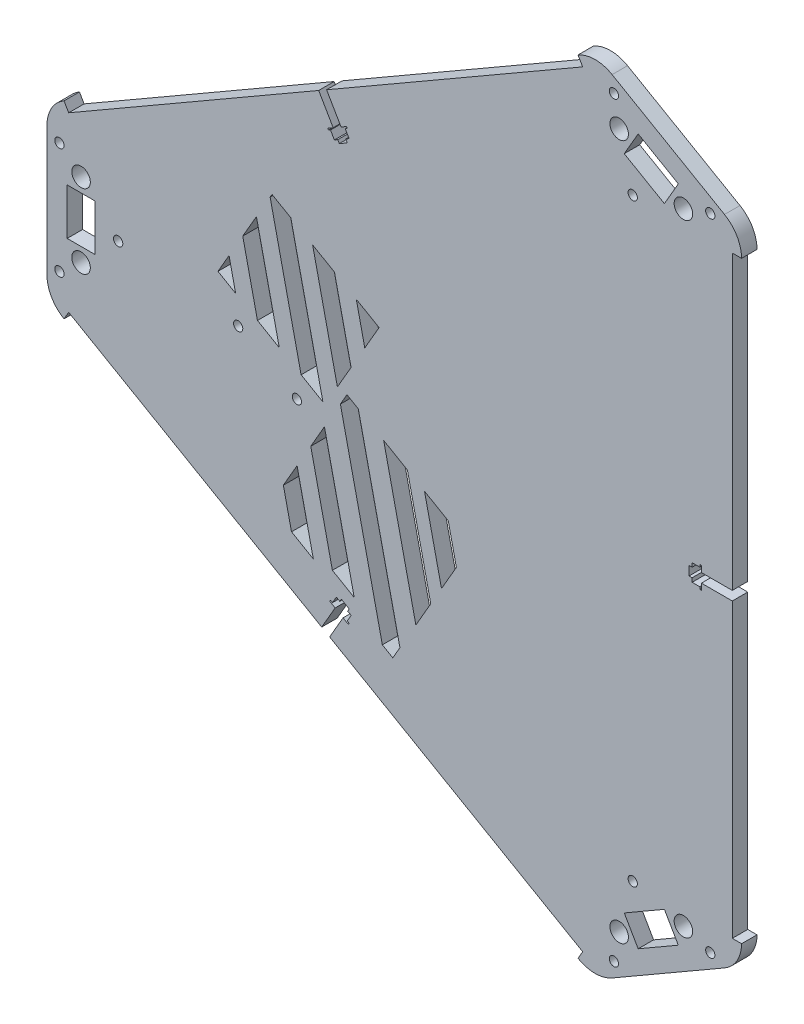
from build123d import *

# Parameters (mm, degrees)
SKETCH1_R           = 3
SKETCH1_R_2         = 1.5
SKETCH1_W           = 9
SKETCH1_H           = 15
BOSS_EXTRUDE1_DEPTH = 5
CUT_EXTRUDE1_DEPTH  = 186.427912319
CUT_EXTRUDE2_DEPTH  = 186.427912319
CUT_EXTRUDE3_DEPTH  = 10
SKETCH4_R           = 1.5
CUT_EXTRUDE4_DEPTH  = 10


with BuildPart() as part:
    # Sketch1 → Boss-Extrude1 (new body)
    with BuildSketch(Plane.XY):
        with BuildLine():
            Line((-127.0125, 27.949853865), (39.300966521, 123.970978531))
            Line((39.300966521, 123.970978531), (37.800966521, 126.569054742))
            ThreePointArc((37.800966521, 126.569054742), (43.313466521, 128.046124665), (48.825966521, 126.569054742))
            Line((48.825966521, 126.569054742), (85.199033479, 105.569054742))
            ThreePointArc((85.199033479, 105.569054742), (89.234463556, 101.533624665), (90.711533479, 96.021124665))
            Line((90.711533479, 96.021124665), (87.711533479, 96.021124665))
            Line((87.711533479, 96.021124665), (87.711533479, -96.021124665))
            Line((87.711533479, -96.021124665), (90.711533479, -96.021124665))
            ThreePointArc((90.711533479, -96.021124665), (89.234463556, -101.533624665), (85.199033479, -105.569054742))
            Line((85.199033479, -105.569054742), (48.825966521, -126.569054742))
            ThreePointArc((48.825966521, -126.569054742), (43.313465898, -128.046124665), (37.800965443, -126.56905412))
            Line((37.800965443, -126.56905412), (39.300965736, -123.970978078))
            Line((39.300965736, -123.970978078), (-127.012489947, -27.949834641))
            Line((-127.012489947, -27.949834641), (-128.512501078, -30.547929455))
            ThreePointArc((-128.512501078, -30.547929455), (-132.547930388, -26.512499461), (-134.025, -21))
            Line((-134.025, -21), (-134.025, 21))
            ThreePointArc((-134.025, 21), (-132.547930077, 26.5125), (-128.5125, 30.547930077))
            Line((-128.5125, 30.547930077), (-127.0125, 27.949853865))
        make_face()
        with Locations((-123, 12)):
            Circle(SKETCH1_R, mode=Mode.SUBTRACT)
        with Locations((-123, -12)):
            Circle(SKETCH1_R, mode=Mode.SUBTRACT)
        with Locations((71.892304845, 100.521124665)):
            Circle(SKETCH1_R, mode=Mode.SUBTRACT)
        with Locations((51.107695155, 112.521124665)):
            Circle(SKETCH1_R, mode=Mode.SUBTRACT)
        with Locations((51.107695155, -112.521124665)):
            Circle(SKETCH1_R, mode=Mode.SUBTRACT)
        with Locations((71.892304845, -100.521124665)):
            Circle(SKETCH1_R, mode=Mode.SUBTRACT)
        with Locations((-111, 0)):
            Circle(SKETCH1_R_2, mode=Mode.SUBTRACT)
        with Locations((55.5, 96.12881982)):
            Circle(SKETCH1_R_2, mode=Mode.SUBTRACT)
        with Locations((55.5, -96.12881982)):
            Circle(SKETCH1_R_2, mode=Mode.SUBTRACT)
        with Locations((-130, 18)):
            Circle(SKETCH1_R_2, mode=Mode.SUBTRACT)
        with Locations((-130, -18)):
            Circle(SKETCH1_R_2, mode=Mode.SUBTRACT)
        with Locations((80.588457268, 103.583302492)):
            Circle(SKETCH1_R_2, mode=Mode.SUBTRACT)
        with Locations((49.411542732, 121.583302492)):
            Circle(SKETCH1_R_2, mode=Mode.SUBTRACT)
        with Locations((49.411542732, -121.583302492)):
            Circle(SKETCH1_R_2, mode=Mode.SUBTRACT)
        with Locations((80.588457268, -103.583302492)):
            Circle(SKETCH1_R_2, mode=Mode.SUBTRACT)
        Polygon((57.254809472, -114.168238983), (70.245190528, -106.668238983), (65.745190528, -98.874010348), (52.754809472, -106.374010348), align=None, mode=Mode.SUBTRACT)
        with Locations((-123, 0)):
            Rectangle(SKETCH1_W, SKETCH1_H, mode=Mode.SUBTRACT)
        Polygon((65.745190528, 98.874010348), (52.754809472, 106.374010348), (57.254809472, 114.168238983), (70.245190528, 106.668238983), align=None, mode=Mode.SUBTRACT)
    extrude(amount=BOSS_EXTRUDE1_DEPTH)

    # Sketch2 → Cut-Extrude1 (cut, through all)
    with BuildSketch(Plane.XY.offset(5)):
        Polygon((87.711533479, 1.48), (77.711533479, 1.48), (77.711533479, 3.5), (77.211533479, 3.5), (77.211533479, 2.75), (74.711533479, 2.75), (74.711533479, 1.48), (73.711533479, 1.48), (73.711533479, -1.48), (74.711533479, -1.48), (74.711533479, -2.75), (77.211533479, -2.75), (77.211533479, -3.5), (77.711533479, -3.5), (77.711533479, -1.48), (87.711533479, -1.48), align=None)
        Polygon((-43.223568195, -77.825416198), (-38.223568195, -69.16516216), (-36.474196879, -70.17516216), (-36.224196879, -69.742149458), (-36.873715932, -69.367149458), (-35.623715932, -67.202085949), (-36.723568195, -66.567085949), (-36.223568195, -65.701060545), (-38.78700339, -64.221060545), (-39.28700339, -65.087085949), (-40.386855653, -64.452085949), (-41.636855653, -66.617149458), (-42.286374706, -66.242149458), (-42.536374706, -66.67516216), (-40.78700339, -67.68516216), (-45.78700339, -76.345416198), align=None)
        Polygon((-46.436522443, 75.220416198), (-41.436522443, 66.56016216), (-43.185893759, 65.55016216), (-42.935893759, 65.117149458), (-42.286374706, 65.492149458), (-41.036374706, 63.327085949), (-39.936522443, 63.962085949), (-39.436522443, 63.096060545), (-36.873087248, 64.576060545), (-37.373087248, 65.442085949), (-36.273234985, 66.077085949), (-37.523234985, 68.242149458), (-36.873715932, 68.617149458), (-37.123715932, 69.05016216), (-38.873087248, 68.04016216), (-43.873087248, 76.700416198), align=None)
    extrude(amount=-CUT_EXTRUDE1_DEPTH, mode=Mode.SUBTRACT)

    # Sketch3 → Cut-Extrude2 (cut, through all)
    with BuildSketch(Plane.XY.offset(5)):
        Polygon((-57.539549529, -41.661428389), (-54.909843958, -53.412518972), (-47.84919289, -57.488988829), (-53.108604032, -33.986807663), align=None)
        Polygon((-48.677658535, -26.312186937), (-41.678771487, -57.587382375), (-34.618120419, -61.663852232), (-44.246713038, -18.637566211), align=None)
        Polygon((-39.093651522, -9.712204179), (-25.516557684, -70.382745138), (-22.133329048, -72.336053611), (-19.825544935, -68.338855316), (-33.293067707, -8.157943131), (-36.970490138, -6.034781747), align=None)
        Polygon((-25.081734637, -12.898759725), (-14.672483419, -59.413493284), (-9.856238314, -51.071514234), (-17.407113911, -17.329705222), align=None)
        Polygon((-11.868595954, -20.527370889), (-6.380514763, -45.05138602), (-1.564269657, -36.70940697), (-4.193975228, -24.958316386), align=None)
    extrude(amount=-CUT_EXTRUDE2_DEPTH, mode=Mode.SUBTRACT)

    # Sketch5 → Cut-Extrude3 (cut)
    with BuildSketch(Plane.XY.offset(5)):
        Polygon((-40.061292463, -5.388208187), (-48.069042542, 30.395188095), (-41.008391474, 26.318718238), (-35.630346966, 2.286412538), align=None)
        Polygon((-66.256008164, 29.241209516), (-58.864982983, -3.786292638), (-65.92563405, 0.290177219), (-70.686953661, 21.56658879), align=None)
        Polygon((-33.947740407, 22.242248381), (-31.199401469, 9.961033264), (-26.568563639, 17.981877577), align=None)
        Polygon((-55.12969361, 34.471657952), (-44.743680847, -11.939232352), (-51.804331915, -7.862762495), (-61.825062667, 36.915830242), (-61.209577533, 37.981881487), align=None)
        Polygon((-75.117899158, 13.891968064), (-72.986285118, 4.366647077), (-78.709580954, 7.670994329), align=None)
    extrude(amount=-CUT_EXTRUDE3_DEPTH, mode=Mode.SUBTRACT)

    # Sketch4 → Cut-Extrude4 (cut)
    with BuildSketch(Plane.XY.offset(5)):
        with Locations((-72.175794174, -4.380771204)):
            Circle(SKETCH4_R)
        with Locations((-53.162424939, -15.35814505)):
            Circle(SKETCH4_R)
    extrude(amount=-CUT_EXTRUDE4_DEPTH, mode=Mode.SUBTRACT)


solid = part.part
